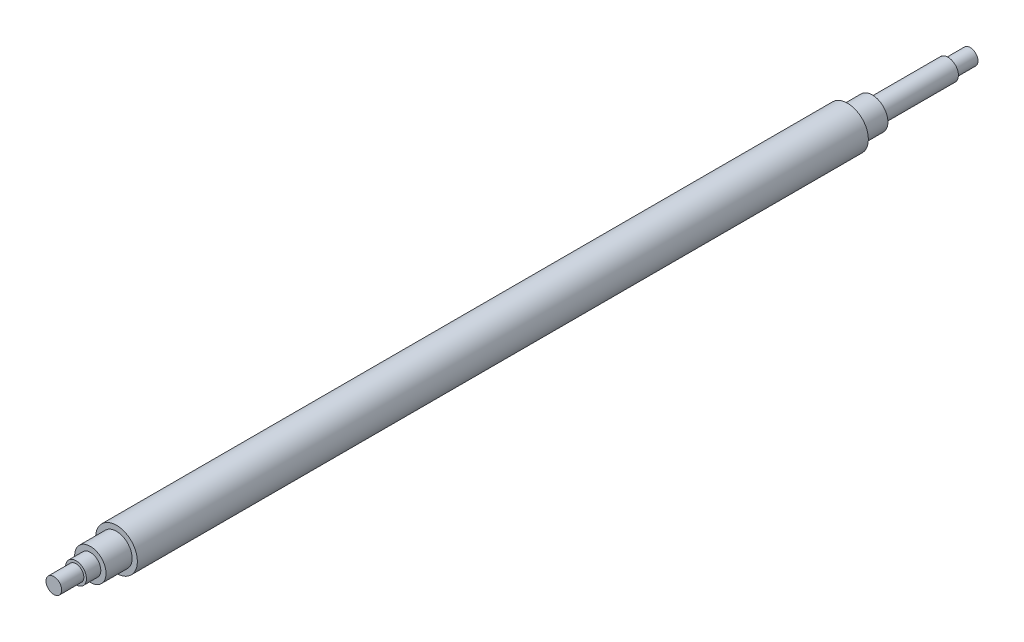
from build123d import *


with BuildPart() as part:
    # Schizzo2 → Rivoluzione2 (revolve)
    with BuildSketch(Plane(origin=(0, 0, 0), x_dir=(0, 0, -1), z_dir=(1, 0, 0))):
        Polygon((0, 0), (0, 3), (8.5, 3), (8.5, 4), (14, 4), (14, 6), (24, 6), (24, 8), (304, 8), (304, 6), (313.5, 6), (313.5, 4), (342.5, 4), (342.5, 3), (351, 3), (351, 0), align=None)
    revolve(axis=Axis((0, 0, 0), (0, 0, -1)))


solid = part.part
